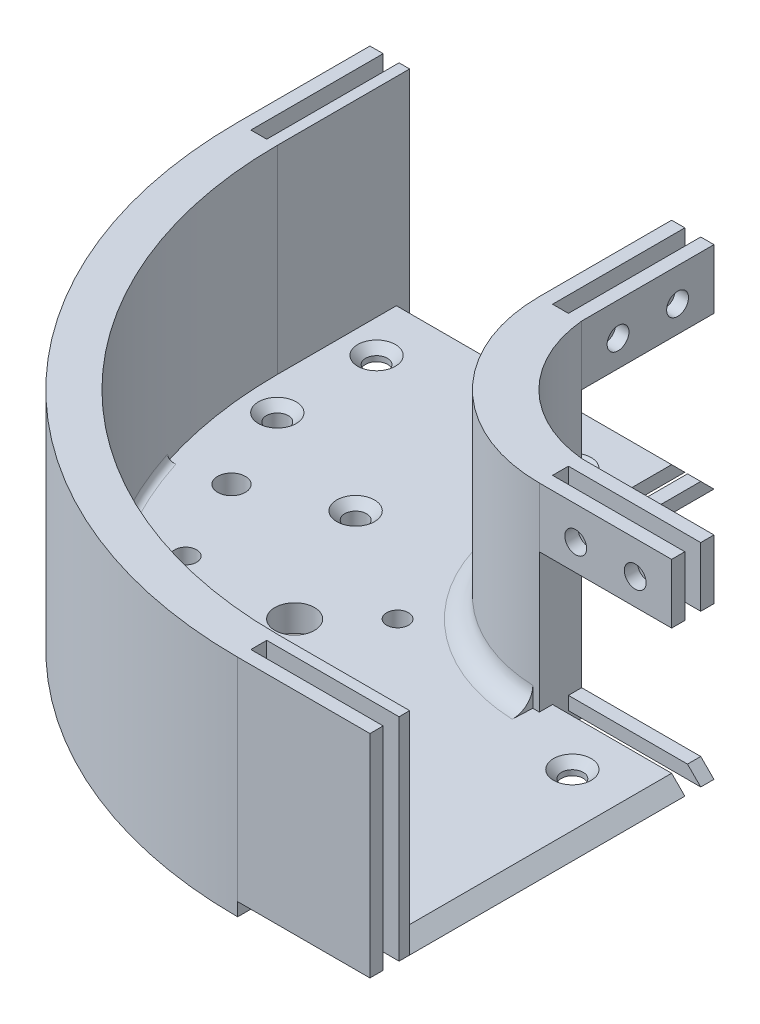
from build123d import *

# Parameters (mm, degrees)
EXTRUDE_1_DEPTH      = 4
CUT_EXTRUDE_1_DEPTH  = 20
SKETCH_3_W           = 2.4000000000000057
SKETCH_3_H           = 1.9982743899914892
CUT_EXTRUDE_2_DEPTH  = 20
EXTRUDE_START        = 30
EXTRUDE_2_DEPTH      = 30
FILLET_5_ANGLE       = 85.303625
FILLET_6_ANGLE       = 54.190138
SKETCH_6_R           = 1.6499999999999986
SKETCH_6_R_2         = 1.6500000000000001
SKETCH_6_R_3         = 1.6500000000000017
SKETCH_6_R_4         = 1.6500000000000021
SKETCH_6_R_5         = 2.1
SKETCH_6_R_6         = 2.099999999999998
SKETCH_6_R_7         = 3.0000000000002798
SKETCH_6_R_8         = 1.6500000000001913
CUT_EXTRUDE_5_DEPTH  = 132.74217244299567
CHAMFER_1_SIZE       = 1.2
SKETCH_7_W           = 20.000000000000014
SKETCH_7_H           = 52.00000000000001
CUT_EXTRUDE_6_DEPTH  = 2
CUT_EXTRUDE_7_REACH  = 132.767
SKETCH_8_R           = 1.6500000000000001
SKETCH_8_R_2         = 1.6500000000000017
SKETCH_8_R_3         = 1.6500000000000021
CHAMFER_2_SIZE       = 1.2
CUT_EXTRUDE_8_DEPTH  = 20
CUT_EXTRUDE_9_DEPTH  = 20
CUT_EXTRUDE_10_REACH = 110.185
SKETCH_13_R          = 1.6500000000000017
CUT_EXTRUDE_11_REACH = 110.185
SKETCH_14_R          = 1.6500000000000017
CHAMFER_3_SIZE       = 2


with BuildPart() as part:
    # 草图1 → 凸台-拉伸1 (new body)
    with BuildSketch(Plane(origin=(0, 0, 0), x_dir=(1, 0, 0), z_dir=(0, 1, 0))):
        with BuildLine():
            Line((70.00000000000051, 0), (90.00000000000003, 0))
            Line((90.00000000000003, 0), (90.00000000000003, 52))
            Line((90.00000000000003, 52), (70.00000000000001, 52))
            ThreePointArc((70.00000000000001, 52), (57.76657649090477, 57.766576490904754), (51.99999999999999, 69.99999999999999))
            Line((51.99999999999999, 69.99999999999999), (51.99999999999999, 90))
            Line((51.99999999999999, 90), (-4.9e-15, 90))
            Line((-4.9e-15, 90), (0, 70.00000000000051))
            ThreePointArc((0, 70.00000000000051), (20.50252531694167, 20.502525316941664), (70.00000000000051, 0))
        make_face()
    extrude(amount=-EXTRUDE_1_DEPTH)

    # 草图2 → 切除-拉伸1 (cut)
    with BuildSketch(Plane(origin=(90.00000000000003, 0, 0), x_dir=(0, 0, -1), z_dir=(1, 0, 0))):
        Polygon((52, -4), (52, -2), (49.99999999999999, -2.0000000000000004), (49.99999999999999, 0), (47.599999999999994, 0), (47.599999999999994, -2.0000000000000004), (4.399999999999515, -2.000000000000006), (4.399999999999515, 0), (1.9999999999997797, 0), (1.9999999999997797, -2.000000000000006), (0, -2.0000000000000067), (0, -4.000000000000006), align=None)
    extrude(amount=-CUT_EXTRUDE_1_DEPTH, mode=Mode.SUBTRACT)

    # 草图3 → 切除-拉伸2 (cut)
    with BuildSketch(Plane(origin=(0, 0, -90), x_dir=(-1, 0, 0), z_dir=(0, 0, -1))):
        Polygon((-49.999999999999986, -1.9982743899914892), (-51.99999999999999, -1.9982743899914892), (-51.99999999999999, -2), (-1.9999999999999858, -2), (-1.999999999999988, -1.9982743899914892), (-4.399999999999984, -1.9982743899914892), (-47.59999999999999, -1.9982743899914892), align=None)
        Polygon((-4.399999999999987, 0), (-4.399999999999987, -1.9982743899914897), (-1.9999999999999858, -1.9982743899914892), (-1.999999999999988, 0), align=None)
        with Locations((-48.79999999999998, -0.9991371949957446)):
            Rectangle(SKETCH_3_W, SKETCH_3_H)
    extrude(amount=-CUT_EXTRUDE_2_DEPTH, mode=Mode.SUBTRACT)

    # 草图4 → 凸台-拉伸2 (add)
    with BuildSketch(Plane(origin=(0, 0, 0), x_dir=(1, 0, 0), z_dir=(0, 1, 0)).offset(EXTRUDE_START)):
        with BuildLine():
            Line((70.00000000000001, 0), (90.00000000000003, 0))
            Line((90.00000000000003, 0), (90.00000000000003, 1.9999999999998899))
            Line((90.00000000000003, 2.0000000000000004), (70.00000000000001, 1.9999999999999982))
            Line((70.00000000000001, 1.9999999999999982), (70.00000000000001, 4.399999999999998))
            Line((70.00000000000001, 4.399999999999998), (90.00000000000003, 4.4))
            Line((90.00000000000004, 4.399999999999758), (90.00000000000004, 6))
            Line((90.00000000000004, 6), (70.00000000000003, 5.999999999999997))
            ThreePointArc((70.00000000000003, 6), (24.745166004060977, 24.745166004060955), (6, 69.99999999999999))
            Line((5.999999999999998, 69.99999999999999), (5.999999999999995, 90))
            Line((5.999999999999995, 90), (4.399999999999987, 90))
            Line((4.399999999999988, 90), (4.399999999999991, 69.99999999999999))
            Line((4.399999999999991, 69.99999999999999), (1.9999999999999896, 69.99999999999999))
            Line((1.9999999999999896, 69.99999999999999), (1.999999999999988, 90))
            Line((1.9999999999999876, 90), (-5.2e-15, 90))
            Line((-5.2e-15, 90), (0, 70))
            ThreePointArc((0, 70), (20.50252531694168, 20.50252531694167), (70.00000000000001, 0))
        make_face()
        with BuildLine():
            Line((70.00000000000001, 45.59999999999999), (90.00000000000003, 45.599999999999994))
            Line((90.00000000000003, 45.599999999999994), (90.00000000000003, 47.599999999999994))
            Line((90.00000000000003, 47.599999999999994), (70.00000000000003, 47.599999999999994))
            Line((70.00000000000003, 47.599999999999994), (70.00000000000003, 49.99999999999999))
            Line((70.00000000000003, 49.99999999999999), (90.00000000000003, 49.99999999999999))
            Line((90.00000000000003, 49.99999999999999), (90.00000000000003, 52))
            Line((90.00000000000003, 52), (70.00000000000001, 52))
            ThreePointArc((70.00000000000001, 52), (57.76657649090477, 57.766576490904754), (52, 69.99999999999999))
            Line((52, 69.99999999999999), (51.99999999999999, 90))
            Line((51.99999999999999, 90), (49.999999999999986, 90))
            Line((49.999999999999986, 90), (49.999999999999986, 70))
            Line((49.999999999999986, 70), (47.59999999999999, 70))
            Line((47.59999999999999, 70), (47.59999999999999, 90))
            Line((47.59999999999999, 90), (45.59999999999999, 90))
            Line((45.59999999999999, 90), (45.59999999999998, 69.99999999999999))
            ThreePointArc((45.59999999999998, 69.99999999999999), (52.74659453904823, 52.74659453904821), (70.00000000000001, 45.59999999999998))
        make_face()
    extrude(amount=-EXTRUDE_2_DEPTH)

    # 圆角5: read off the stored shape, not the designer's step
    # 圆角5 outline → 圆角5 (revolve)
    with BuildSketch(Plane(origin=(70, 0, -70), x_dir=(-0.9991602895420396, 0, 0.040972134460723175), z_dir=(-0.040972134460723175, 0, -0.9991602895420396))):
        with BuildLine():
            Line((24.4, 0), (27.4, 0))
            ThreePointArc((27.4, 0), (25.278679656, 0.878679656), (24.4, 3))
            Line((24.4, 3), (24.4, 0))
        make_face()
    revolve(axis=Axis((70, 0, -70), (0, 1, 0)), revolution_arc=FILLET_5_ANGLE)

    # 圆角6: read off the stored shape, not the designer's step
    # 圆角6 outline → 圆角6 (revolve)
    with BuildSketch(Plane(origin=(70, 0, -70), x_dir=(-0.9515679480481721, 0, 0.30743851458038096), z_dir=(-0.30743851458038096, 0, -0.9515679480481721))):
        with BuildLine():
            Line((64, 0), (64, 1))
            ThreePointArc((64, 1), (63.707106781, 0.292893219), (63, 0))
            Line((63, 0), (64, 0))
        make_face()
    revolve(axis=Axis((70, 0, -70), (0, 0.9999999999999999, 0)), revolution_arc=FILLET_6_ANGLE)

    # 草图6 → 切除-拉伸5 (cut, through all)
    with BuildSketch(Plane.XZ.offset(4)):
        with Locations(Location((22.837948979535952, -39.3122020414769, 0), (0, 0, 270))):
            Circle(SKETCH_6_R)
        with Locations(Location((10.99999999999999, -64.99999999999999, 0), (0, 0, 270))):
            Circle(SKETCH_6_R_2)
        with Locations(Location((29.762873469029515, -58.07507551050643, 0), (0, 0, 270))):
            Circle(SKETCH_6_R)
        with Locations(Location((58.07507551050634, -29.762873469029486, 0), (0, 0, 270))):
            Circle(SKETCH_6_R_3)
        with Locations(Location((64.99999999999996, -10.999999999999996, 0), (0, 0, 270))):
            Circle(SKETCH_6_R_4)
        with Locations(Location((39.31220204147682, -22.837948979535867, 0), (0, 0, 270))):
            Circle(SKETCH_6_R_3)
        with Locations(Location((16.918974489767926, -52.156101020738404, 0), (0, 0, 270))):
            Circle(SKETCH_6_R_5)
        with Locations(Location((52.15610102073839, -16.91897448976793, 0), (0, 0, 270))):
            Circle(SKETCH_6_R_6)
        with Locations(Location((39.312202041476624, -39.31220204147684, 0), (0, 0, 270))):
            Circle(SKETCH_6_R_7)
        with Locations(Location((47.090376634528674, -47.09037663452883, 0), (0, 0, 270))):
            Circle(SKETCH_6_R_8)
    extrude(amount=-CUT_EXTRUDE_5_DEPTH, mode=Mode.SUBTRACT)

    # 倒角1
    chamfer_1_edges = [part.edges().sort_by_distance(p)[0] for p in [
        (10.999999999999991, 0, -63.34999999999999),
        (58.07507551050634, 0, -28.112873469029484),
        (64.99999999999996, 0, -9.349999999999994),
        (29.762873469029515, 0, -56.42507551050643),
    ]]
    chamfer(chamfer_1_edges, length=CHAMFER_1_SIZE)

    # 草图7 → 切除-拉伸6 (cut)
    with BuildSketch(Plane.XZ.offset(4)):
        Polygon((-4.9e-15, -90), (51.99999999999999, -90), (51.99999999999999, -69.99999999999999), (0, -69.99999999999999), align=None)
        with Locations((80.00000000000003, -26.000000000000004)):
            Rectangle(SKETCH_7_W, SKETCH_7_H)
    extrude(amount=-CUT_EXTRUDE_6_DEPTH, mode=Mode.SUBTRACT)

    # 草图8 → 切除-拉伸7 (cut, up to next)
    with BuildSketch(Plane(origin=(0, 0, 0), x_dir=(1, 0, 0), z_dir=(0, 1, 0)), mode=Mode.PRIVATE) as cut_extrude_7_sk1:
        with Locations(Location((10.999999999999998, 79.99999999999999, 0), (0, 0, 270))):
            Circle(SKETCH_8_R)
    cut_extrude_7_tool1 = extrude(cut_extrude_7_sk1.sketch, amount=-CUT_EXTRUDE_7_REACH, mode=Mode.PRIVATE) & part.part
    # 草图8 → 切除-拉伸7 (cut, up to next)
    with BuildSketch(Plane(origin=(0, 0, 0), x_dir=(1, 0, 0), z_dir=(0, 1, 0)), mode=Mode.PRIVATE) as cut_extrude_7_sk2:
        with Locations(Location((40.59999999999998, 79.99999999999999, 0), (0, 0, 90))):
            Circle(SKETCH_8_R_2)
    cut_extrude_7_tool2 = extrude(cut_extrude_7_sk2.sketch, amount=-CUT_EXTRUDE_7_REACH, mode=Mode.PRIVATE) & part.part
    # 草图8 → 切除-拉伸7 (cut, up to next)
    with BuildSketch(Plane(origin=(0, 0, 0), x_dir=(1, 0, 0), z_dir=(0, 1, 0)), mode=Mode.PRIVATE) as cut_extrude_7_sk3:
        with Locations(Location((79.99999999999993, 40.599999999999966, 0), (0, 0, 270))):
            Circle(SKETCH_8_R_2)
    cut_extrude_7_tool3 = extrude(cut_extrude_7_sk3.sketch, amount=-CUT_EXTRUDE_7_REACH, mode=Mode.PRIVATE) & part.part
    # 草图8 → 切除-拉伸7 (cut, up to next)
    with BuildSketch(Plane(origin=(0, 0, 0), x_dir=(1, 0, 0), z_dir=(0, 1, 0)), mode=Mode.PRIVATE) as cut_extrude_7_sk4:
        with Locations(Location((80.00000000000007, 10.999999999999982, 0), (0, 0, 270))):
            Circle(SKETCH_8_R_3)
    cut_extrude_7_tool4 = extrude(cut_extrude_7_sk4.sketch, amount=-CUT_EXTRUDE_7_REACH, mode=Mode.PRIVATE) & part.part
    add(cut_extrude_7_tool1.solids().sort_by_distance((11, 0, -80))[0], mode=Mode.SUBTRACT)
    add(cut_extrude_7_tool2.solids().sort_by_distance((40.6, 0, -80))[0], mode=Mode.SUBTRACT)
    add(cut_extrude_7_tool3.solids().sort_by_distance((80, 0, -40.6))[0], mode=Mode.SUBTRACT)
    add(cut_extrude_7_tool4.solids().sort_by_distance((80, 0, -11))[0], mode=Mode.SUBTRACT)

    # 倒角2
    chamfer_2_edges = [part.edges().sort_by_distance(p)[0] for p in [
        (11, 0, -81.64999999999999),
        (40.59999999999998, 0, -78.34999999999998),
        (79.99999999999993, 0, -42.249999999999964),
        (80.00000000000007, 0, -12.649999999999984),
    ]]
    chamfer(chamfer_2_edges, length=CHAMFER_2_SIZE)

    # 草图10 → 切除-拉伸8 (cut)
    with BuildSketch(Plane(origin=(0, 0, -90), x_dir=(-1, 0, 0), z_dir=(0, 0, -1))):
        Polygon((-56.79999999999999, -4.02e-15), (-40.79999999999999, 4.34e-15), (-40.79999999999999, 21.000000000000007), (-56.79999999999999, 21.000000000000004), align=None)
    extrude(amount=-CUT_EXTRUDE_8_DEPTH, mode=Mode.SUBTRACT)

    # 草图11 → 切除-拉伸9 (cut)
    with BuildSketch(Plane(origin=(90.00000000000003, 0, -90.00000000000003), x_dir=(0, 0, 1), z_dir=(-1, 0, 0))):
        Polygon((33.20000000000003, -1.53e-15), (49.20000000000003, 4.34e-15), (49.20000000000003, 21.000000000000007), (33.20000000000003, 21), align=None)
    extrude(amount=CUT_EXTRUDE_9_DEPTH, mode=Mode.SUBTRACT)

    # 切除-拉伸10: up to this face of the body (flat: up to its plane)
    cut_extrude_10_end = Plane(part.part.faces().sort_by_distance((80, 25.5, -45.6))[0])
    # 草图13 → 切除-拉伸10 (cut, up to the picked face)
    with BuildSketch(Plane(origin=(0, 0, -52), x_dir=(-1, 0, 0), z_dir=(0, 0, -1)), mode=Mode.PRIVATE) as cut_extrude_10_sk1:
        with Locations((-84.50000000000001, 25)):
            Circle(SKETCH_13_R)
    cut_extrude_10_tool1 = split(extrude(cut_extrude_10_sk1.sketch, amount=-CUT_EXTRUDE_10_REACH, mode=Mode.PRIVATE), bisect_by=cut_extrude_10_end, keep=Keep.BOTH, mode=Mode.PRIVATE)
    # 草图13 → 切除-拉伸10 (cut, up to the picked face)
    with BuildSketch(Plane(origin=(0, 0, -52), x_dir=(-1, 0, 0), z_dir=(0, 0, -1)), mode=Mode.PRIVATE) as cut_extrude_10_sk2:
        with Locations((-75.50000000000001, 25)):
            Circle(SKETCH_13_R)
    cut_extrude_10_tool2 = split(extrude(cut_extrude_10_sk2.sketch, amount=-CUT_EXTRUDE_10_REACH, mode=Mode.PRIVATE), bisect_by=cut_extrude_10_end, keep=Keep.BOTH, mode=Mode.PRIVATE)
    add(cut_extrude_10_tool1.solids().sort_by(Axis((84.5, 25, -52), (0, 0, 1)))[0], mode=Mode.SUBTRACT)
    add(cut_extrude_10_tool2.solids().sort_by(Axis((75.5, 25, -52), (0, 0, 1)))[0], mode=Mode.SUBTRACT)

    # 切除-拉伸11: up to this face of the body (flat: up to its plane)
    cut_extrude_11_end = Plane(part.part.faces().sort_by_distance((45.6, 25.5, -80))[0])
    # 草图14 → 切除-拉伸11 (cut, up to the picked face)
    with BuildSketch(Plane(origin=(51.99999999999999, 0, 0), x_dir=(0, 0, -1), z_dir=(1, 0, 0)), mode=Mode.PRIVATE) as cut_extrude_11_sk1:
        with Locations((75.49999999999999, 25)):
            Circle(SKETCH_14_R)
    cut_extrude_11_tool1 = split(extrude(cut_extrude_11_sk1.sketch, amount=-CUT_EXTRUDE_11_REACH, mode=Mode.PRIVATE), bisect_by=cut_extrude_11_end, keep=Keep.BOTH, mode=Mode.PRIVATE)
    # 草图14 → 切除-拉伸11 (cut, up to the picked face)
    with BuildSketch(Plane(origin=(51.99999999999999, 0, 0), x_dir=(0, 0, -1), z_dir=(1, 0, 0)), mode=Mode.PRIVATE) as cut_extrude_11_sk2:
        with Locations((84.49999999999999, 25)):
            Circle(SKETCH_14_R)
    cut_extrude_11_tool2 = split(extrude(cut_extrude_11_sk2.sketch, amount=-CUT_EXTRUDE_11_REACH, mode=Mode.PRIVATE), bisect_by=cut_extrude_11_end, keep=Keep.BOTH, mode=Mode.PRIVATE)
    add(cut_extrude_11_tool1.solids().sort_by(Axis((52, 25, -75.5), (-1, 0, 0)))[0], mode=Mode.SUBTRACT)
    add(cut_extrude_11_tool2.solids().sort_by(Axis((52, 25, -84.5), (-1, 0, 0)))[0], mode=Mode.SUBTRACT)

    # 倒角3
    # the kernel refuses this chamfer: 2 mm, written as the material it takes off along each edge
    with BuildSketch(Plane(origin=(90.00000000000004, 0, -6), x_dir=(-1, -6.8e-16, 3.4e-16), z_dir=(-3.4e-16, 6e-17, -1))) as chamfer_3_piece_1:
        Polygon((CHAMFER_3_SIZE, 0), (1.35e-15, -CHAMFER_3_SIZE), (0, 0), align=None)
    extrude(amount=46.74336597593182, mode=Mode.SUBTRACT)
    with BuildSketch(Plane(origin=(52.74336597593182, 4.4e-16, -90), x_dir=(0, -1e-16, 1), z_dir=(-1, -1e-17, 0))) as chamfer_3_piece_2:
        Polygon((CHAMFER_3_SIZE, 0), (2e-16, -CHAMFER_3_SIZE), (0, 0), align=None)
    extrude(amount=46.74336597593183, mode=Mode.SUBTRACT)
    with BuildSketch(Plane(origin=(90.00000000000003, 5.143365975931836, -52), x_dir=(-1, 0, 0), z_dir=(0, -1, 0))) as chamfer_3_piece_3_section:
        Polygon((CHAMFER_3_SIZE, 0), (0, -CHAMFER_3_SIZE), (0, 0), align=None)
    chamfer_3_piece_3 = extrude(amount=12.286731951863672, mode=Mode.PRIVATE)
    chamfer_3_piece_3 = split(chamfer_3_piece_3, bisect_by=Plane(origin=(86.42831701203411, 1.5716829879659158, -52), z_dir=(0.7071067811865476, 0.7071067811865476, 0)), keep=Keep.TOP, mode=Mode.PRIVATE)
    add(chamfer_3_piece_3, mode=Mode.SUBTRACT)
    with BuildSketch(Plane(origin=(57.14336597593183, -4.19e-15, -90), x_dir=(0, 0, 1), z_dir=(-1, 5.2e-16, 0))) as chamfer_3_piece_4:
        Polygon((CHAMFER_3_SIZE, 0), (0, -CHAMFER_3_SIZE), (0, 0), align=None)
    extrude(amount=12.286731951863679, mode=Mode.SUBTRACT)
    with BuildSketch(Plane(origin=(90.00000000000003, -7.143365975931836, -49.99999999999999), x_dir=(-1, 0, 0), z_dir=(0, 1, 0))) as chamfer_3_piece_5_section:
        Polygon((CHAMFER_3_SIZE, 0), (0, -CHAMFER_3_SIZE), (0, 0), align=None)
    chamfer_3_piece_5 = extrude(amount=12.286731951863672, mode=Mode.PRIVATE)
    chamfer_3_piece_5 = split(chamfer_3_piece_5, bisect_by=Plane(origin=(92.57168298796594, -4.57168298796592, -49.99999999999999), z_dir=(0.7071067811865476, 0.7071067811865476, 0)), keep=Keep.TOP, mode=Mode.PRIVATE)
    add(chamfer_3_piece_5, mode=Mode.SUBTRACT)
    with BuildSketch(Plane(origin=(90.00000000000003, -1.65e-15, -57.143365975931836), x_dir=(-1, 0, 0), z_dir=(0, 3.7e-16, 1))) as chamfer_3_piece_6:
        Polygon((CHAMFER_3_SIZE, 0), (0, CHAMFER_3_SIZE), (0, 0), align=None)
    extrude(amount=12.286731951863679, mode=Mode.SUBTRACT)
    with BuildSketch(Plane(origin=(90.00000000000003, 5.1433659759318395, -47.599999999999994), x_dir=(0, 0, 1), z_dir=(0, -1, 0))) as chamfer_3_piece_7_section:
        Polygon((CHAMFER_3_SIZE, 0), (0, CHAMFER_3_SIZE), (0, 0), align=None)
    chamfer_3_piece_7 = extrude(amount=12.286731951863676, mode=Mode.PRIVATE)
    chamfer_3_piece_7 = split(chamfer_3_piece_7, bisect_by=Plane(origin=(86.42831701203411, 1.5716829879659207, -47.599999999999994), z_dir=(0.7071067811865474, 0.7071067811865478, 0)), keep=Keep.TOP, mode=Mode.PRIVATE)
    add(chamfer_3_piece_7, mode=Mode.SUBTRACT)
    with BuildSketch(Plane(origin=(51.99999999999999, -7.141640365923324, -90), x_dir=(0, 0, 1), z_dir=(0, 1, 0))) as chamfer_3_piece_8_section:
        Polygon((CHAMFER_3_SIZE, 0), (0, -CHAMFER_3_SIZE), (0, 0), align=None)
    chamfer_3_piece_8 = extrude(amount=12.285006341855158, mode=Mode.PRIVATE)
    chamfer_3_piece_8 = split(chamfer_3_piece_8, bisect_by=Plane(origin=(51.99999999999999, -4.570820182961664, -92.57082018296165), z_dir=(0, 0.7071067811865476, -0.7071067811865475)), keep=Keep.TOP, mode=Mode.PRIVATE)
    add(chamfer_3_piece_8, mode=Mode.SUBTRACT)
    with BuildSketch(Plane(origin=(47.59999999999999, 5.143365975931836, -90), x_dir=(0, 0, 1), z_dir=(0, -1, 0))) as chamfer_3_piece_9_section:
        Polygon((CHAMFER_3_SIZE, 0), (0, CHAMFER_3_SIZE), (0, 0), align=None)
    chamfer_3_piece_9 = extrude(amount=12.285006341855158, mode=Mode.PRIVATE)
    chamfer_3_piece_9 = split(chamfer_3_piece_9, bisect_by=Plane(origin=(47.59999999999999, 1.5716829879659189, -86.42831701203409), z_dir=(0, 0.7071067811865476, -0.7071067811865475)), keep=Keep.TOP, mode=Mode.PRIVATE)
    add(chamfer_3_piece_9, mode=Mode.SUBTRACT)
    with BuildSketch(Plane(origin=(49.999999999999986, -7.141640365923324, -90), x_dir=(0, 0, 1), z_dir=(0, 1, 0))) as chamfer_3_piece_10_section:
        Polygon((CHAMFER_3_SIZE, 0), (0, CHAMFER_3_SIZE), (0, 0), align=None)
    chamfer_3_piece_10 = extrude(amount=12.285006341855158, mode=Mode.PRIVATE)
    chamfer_3_piece_10 = split(chamfer_3_piece_10, bisect_by=Plane(origin=(49.999999999999986, -4.570820182961663, -92.57082018296165), z_dir=(0, 0.7071067811865476, -0.7071067811865475)), keep=Keep.TOP, mode=Mode.PRIVATE)
    add(chamfer_3_piece_10, mode=Mode.SUBTRACT)


solid = part.part
